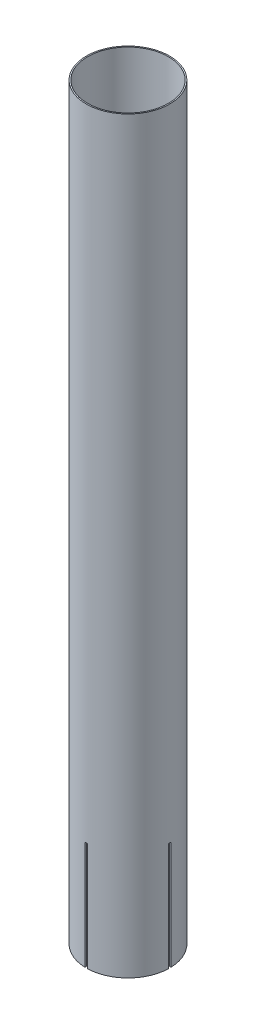
from build123d import *

# Parameters (mm, degrees)
BOSS_EXTRUDE1_DEPTH      = 725
BOSS_EXTRUDE1_DEPTH_BACK = 725
SKETCH1_R                = 80.75
SKETCH1_R_2              = 78.35
SKETCH2_W                = 5
SKETCH2_H                = 210
CUT_EXTRUDE1_DEPTH       = 734.938774694
CIRPATTERN1_START        = -725
CIRPATTERN1_DEPTH        = 210


# Read off the part's stored shape, not the designer's step: CirPattern1
with BuildPart() as part:
    # Sketch1 → Boss-Extrude1 (new, two sides: drawn at the far end of the back side and taken through both)
    with BuildSketch(Plane(origin=(0, 0, 0), x_dir=(1, 0, 0), z_dir=(0, 1, 0)).offset(-BOSS_EXTRUDE1_DEPTH_BACK)):
        with Locations(Location((0, 0, 0), (0, 0, 270))):
            Circle(SKETCH1_R)
        with Locations(Location((0, 0, 0), (0, 0, 270))):
            Circle(SKETCH1_R_2, mode=Mode.SUBTRACT)
    extrude(amount=BOSS_EXTRUDE1_DEPTH + BOSS_EXTRUDE1_DEPTH_BACK)

    # Sketch2 → Cut-Extrude1 (cut, symmetric)
    with BuildSketch(Plane.XY):
        with Locations((0, -620)):
            Rectangle(SKETCH2_W, SKETCH2_H)
    extrude(amount=CUT_EXTRUDE1_DEPTH, both=True, mode=Mode.SUBTRACT)

    # CirPattern1 outline → CirPattern1 (cut)
    with BuildSketch(Plane(origin=(0, 0, 0), x_dir=(1, 0, 0), z_dir=(0, 1, 0)).offset(CIRPATTERN1_START)):
        with BuildLine():
            ThreePointArc((-80.711291032, 2.5), (-80.75, 0), (-80.711291032, -2.5))
            Line((-80.711291032, -2.5), (-78.310104712, -2.5))
            ThreePointArc((-78.310104712, -2.5), (-78.35, 0), (-78.310104712, 2.5))
            Line((-78.310104712, 2.5), (-80.711291032, 2.5))
        make_face()
        with BuildLine():
            Line((78.310104712, -2.5), (80.711291032, -2.5))
            ThreePointArc((80.711291032, -2.5), (80.75, 0), (80.711291032, 2.5))
            Line((80.711291032, 2.5), (78.310104712, 2.5))
            ThreePointArc((78.310104712, 2.5), (78.35, 0), (78.310104712, -2.5))
        make_face()
    extrude(amount=CIRPATTERN1_DEPTH, mode=Mode.SUBTRACT)


solid = part.part
